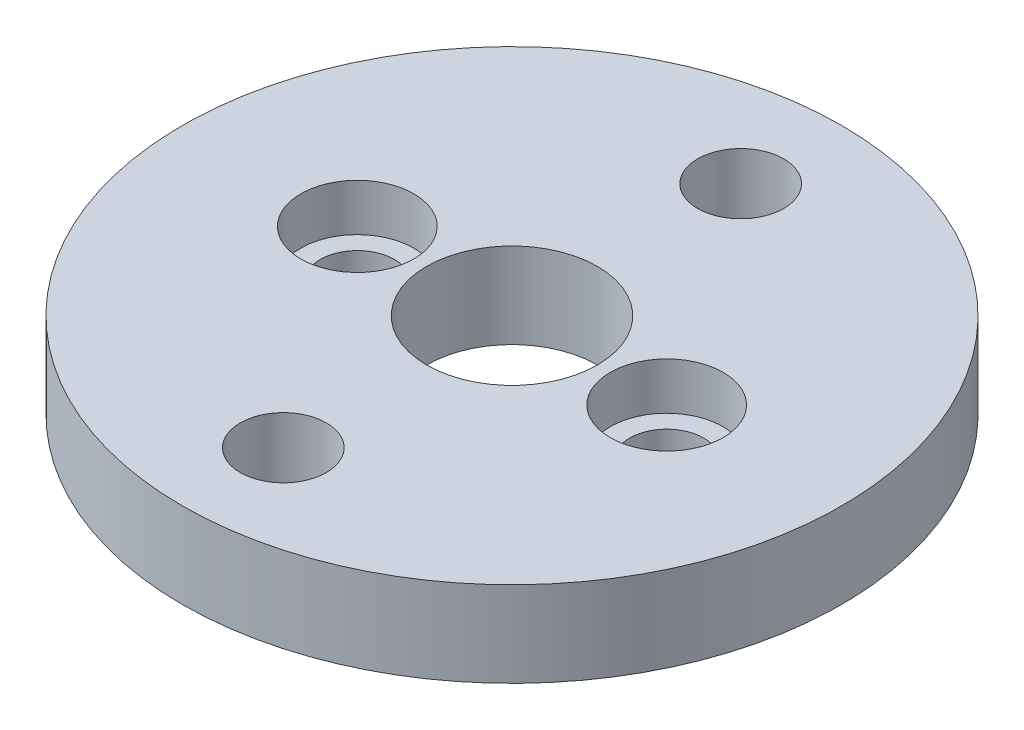
from build123d import *

# Parameters (mm, degrees)
SKETCH1_R           = 12.25
BOSS_EXTRUDE1_DEPTH = 3.175
CUT_EXTRUDE1_REACH  = 19.613
SKETCH2_R           = 3.175
SKETCH2_R_2         = 1.6
SKETCH2_R_3         = 1.375
SKETCH3_R           = 2.1
CUT_EXTRUDE2_DEPTH  = 1.75


with BuildPart() as part:
    # Sketch1 → Boss-Extrude1 (new body)
    with BuildSketch(Plane(origin=(0, 0, 0), x_dir=(1, 0, 0), z_dir=(0, 1, 0))):
        Circle(SKETCH1_R)
    extrude(amount=BOSS_EXTRUDE1_DEPTH)

    # Sketch2 → Cut-Extrude1 (cut, up to next)
    with BuildSketch(Plane.XZ, mode=Mode.PRIVATE) as cut_extrude1_sk1:
        Circle(SKETCH2_R)
    cut_extrude1_tool1 = extrude(cut_extrude1_sk1.sketch, amount=-CUT_EXTRUDE1_REACH, mode=Mode.PRIVATE) & part.part
    # Sketch2 → Cut-Extrude1 (cut, up to next)
    with BuildSketch(Plane.XZ, mode=Mode.PRIVATE) as cut_extrude1_sk2:
        with Locations((0, 8.5)):
            Circle(SKETCH2_R_2)
    cut_extrude1_tool2 = extrude(cut_extrude1_sk2.sketch, amount=-CUT_EXTRUDE1_REACH, mode=Mode.PRIVATE) & part.part
    # Sketch2 → Cut-Extrude1 (cut, up to next)
    with BuildSketch(Plane.XZ, mode=Mode.PRIVATE) as cut_extrude1_sk3:
        with Locations((0, -8.5)):
            Circle(SKETCH2_R_2)
    cut_extrude1_tool3 = extrude(cut_extrude1_sk3.sketch, amount=-CUT_EXTRUDE1_REACH, mode=Mode.PRIVATE) & part.part
    # Sketch2 → Cut-Extrude1 (cut, up to next)
    with BuildSketch(Plane.XZ, mode=Mode.PRIVATE) as cut_extrude1_sk4:
        with Locations((-5.75, 0)):
            Circle(SKETCH2_R_3)
    cut_extrude1_tool4 = extrude(cut_extrude1_sk4.sketch, amount=-CUT_EXTRUDE1_REACH, mode=Mode.PRIVATE) & part.part
    # Sketch2 → Cut-Extrude1 (cut, up to next)
    with BuildSketch(Plane.XZ, mode=Mode.PRIVATE) as cut_extrude1_sk5:
        with Locations((5.75, 0)):
            Circle(SKETCH2_R_3)
    cut_extrude1_tool5 = extrude(cut_extrude1_sk5.sketch, amount=-CUT_EXTRUDE1_REACH, mode=Mode.PRIVATE) & part.part
    add(cut_extrude1_tool1.solids().sort_by_distance((0, 0, 0))[0], mode=Mode.SUBTRACT)
    add(cut_extrude1_tool2.solids().sort_by_distance((0, 0, 8.5))[0], mode=Mode.SUBTRACT)
    add(cut_extrude1_tool3.solids().sort_by_distance((0, 0, -8.5))[0], mode=Mode.SUBTRACT)
    add(cut_extrude1_tool4.solids().sort_by_distance((-5.75, 0, 0))[0], mode=Mode.SUBTRACT)
    add(cut_extrude1_tool5.solids().sort_by_distance((5.75, 0, 0))[0], mode=Mode.SUBTRACT)

    # Sketch3 → Cut-Extrude2 (cut)
    with BuildSketch(Plane(origin=(0, 3.175, 0), x_dir=(1, 0, 0), z_dir=(0, 1, 0))):
        with Locations((-5.75, 0)):
            Circle(SKETCH3_R)
        with Locations((5.75, 0)):
            Circle(SKETCH3_R)
    extrude(amount=-CUT_EXTRUDE2_DEPTH, mode=Mode.SUBTRACT)


solid = part.part
